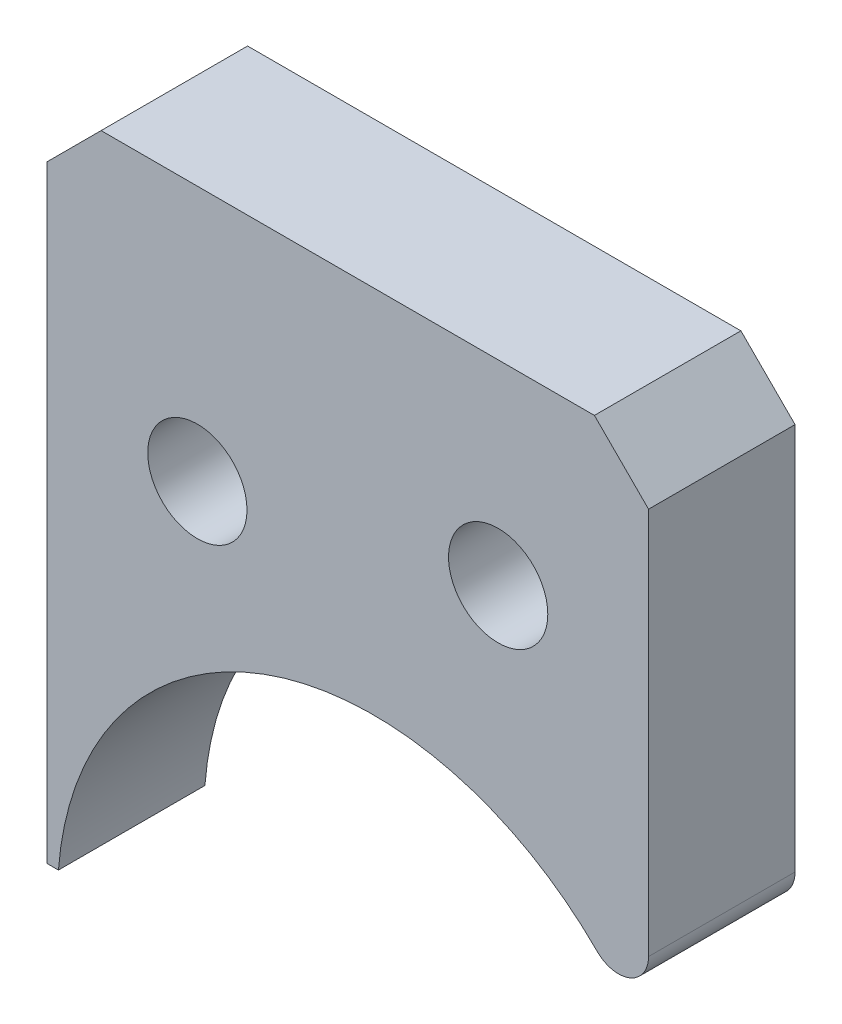
from build123d import *

# Parameters (mm, degrees)
BOSS_EXTRUDE1_DEPTH = 4.87
SKETCH2_R           = 1.65
CUT_EXTRUDE1_DEPTH  = 4.87
CHAMFER1_SIZE       = 1.8
FILLET2_R           = 1


with BuildPart() as part:
    # Sketch1 → Boss-Extrude1 (new body)
    with BuildSketch(Plane.XY):
        with BuildLine():
            Line((0, 22), (20, 22))
            Line((20, 22), (20, 4.35889894))
            ThreePointArc((20, 4.35889894), (8.574134629, 9.455732011), (0.381623477, 0))
            Line((0.381623477, 0), (0, 0))
            Line((0, 0), (0, 22))
        make_face()
    extrude(amount=BOSS_EXTRUDE1_DEPTH)

    # Sketch2 → Cut-Extrude1 (cut)
    with BuildSketch(Plane.XY.offset(4.87)):
        with Locations((5, 13.5)):
            Circle(SKETCH2_R)
        with Locations((15, 15.5)):
            Circle(SKETCH2_R)
    extrude(amount=-CUT_EXTRUDE1_DEPTH, mode=Mode.SUBTRACT)

    # Chamfer1
    chamfer1_edges = [part.edges().sort_by_distance(p)[0] for p in [
        (20, 22, 2.435),
        (0, 22, 2.435),
    ]]
    chamfer(chamfer1_edges, length=CHAMFER1_SIZE)

    # Fillet2
    fillet2_edges = [part.edges().sort_by_distance(p)[0] for p in [
        (20, 4.35889894, 2.435),
    ]]
    fillet(fillet2_edges, radius=FILLET2_R)


solid = part.part
